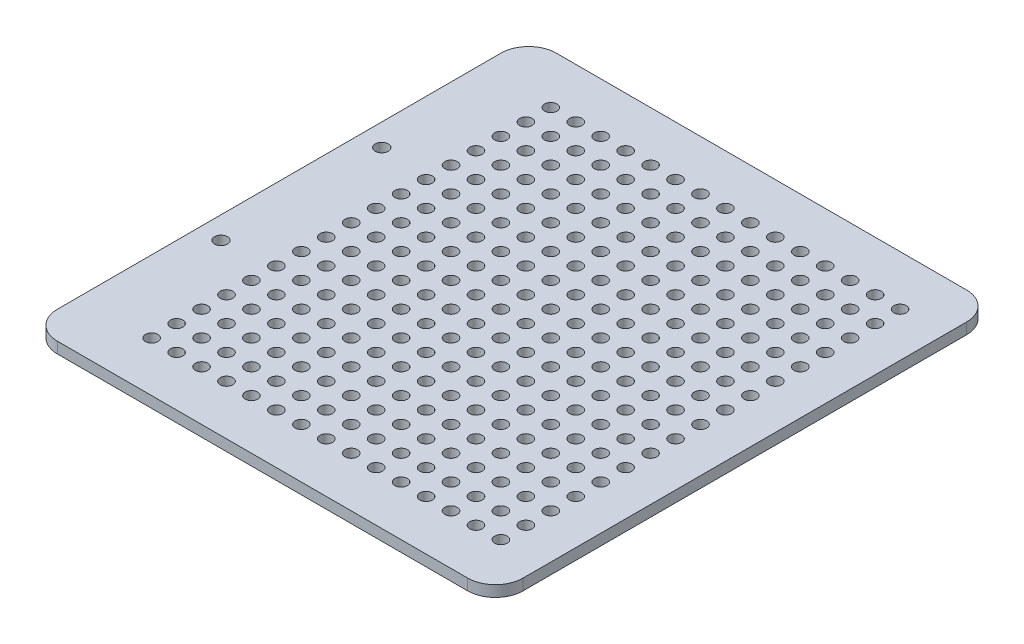
from build123d import *

# Parameters (mm, degrees)
SKETCH_1_W          = 168
SKETCH_1_H          = 180
EXTRUDE_1_DEPTH     = 4
SKETCH_3_R          = 2.336648517
CUT_EXTRUDE_1_DEPTH = 4
SKETCH_5_R          = 2.25
CUT_EXTRUDE_2_DEPTH = 4
FILLET_1_R          = 10


with BuildPart() as part:
    # 草图1 → 凸台-拉伸1 (new body)
    with BuildSketch(Plane(origin=(0, 0, 0), x_dir=(1, 0, 0), z_dir=(0, 1, 0))):
        with Locations((84, -90)):
            Rectangle(SKETCH_1_W, SKETCH_1_H)
    extrude(amount=EXTRUDE_1_DEPTH)

    # 草图3 → 切除-拉伸1 (cut)
    with BuildSketch(Plane(origin=(0, 4, 0), x_dir=(1, 0, 0), z_dir=(0, 1, 0))):
        with Locations((8, -61)):
            Circle(SKETCH_3_R)
        with Locations((8, -119)):
            Circle(SKETCH_3_R)
    extrude(amount=-CUT_EXTRUDE_1_DEPTH, mode=Mode.SUBTRACT)

    # 草图5 → 切除-拉伸2 (cut)
    with BuildSketch(Plane(origin=(0, 4, 0), x_dir=(1, 0, 0), z_dir=(0, 1, 0))):
        with Locations((26, -18)):
            Circle(SKETCH_5_R)
        with Locations((35, -18)):
            Circle(SKETCH_5_R)
        with Locations((44, -18)):
            Circle(SKETCH_5_R)
        with Locations((53, -18)):
            Circle(SKETCH_5_R)
        with Locations((62, -18)):
            Circle(SKETCH_5_R)
        with Locations((71, -18)):
            Circle(SKETCH_5_R)
        with Locations((80, -18)):
            Circle(SKETCH_5_R)
        with Locations((89, -18)):
            Circle(SKETCH_5_R)
        with Locations((98, -18)):
            Circle(SKETCH_5_R)
        with Locations((107, -18)):
            Circle(SKETCH_5_R)
        with Locations((116, -18)):
            Circle(SKETCH_5_R)
        with Locations((125, -18)):
            Circle(SKETCH_5_R)
        with Locations((134, -18)):
            Circle(SKETCH_5_R)
        with Locations((143, -18)):
            Circle(SKETCH_5_R)
        with Locations((152, -18)):
            Circle(SKETCH_5_R)
        with Locations((35, -27)):
            Circle(SKETCH_5_R)
        with Locations((44, -27)):
            Circle(SKETCH_5_R)
        with Locations((53, -27)):
            Circle(SKETCH_5_R)
        with Locations((62, -27)):
            Circle(SKETCH_5_R)
        with Locations((71, -27)):
            Circle(SKETCH_5_R)
        with Locations((80, -27)):
            Circle(SKETCH_5_R)
        with Locations((89, -27)):
            Circle(SKETCH_5_R)
        with Locations((98, -27)):
            Circle(SKETCH_5_R)
        with Locations((107, -27)):
            Circle(SKETCH_5_R)
        with Locations((116, -27)):
            Circle(SKETCH_5_R)
        with Locations((125, -27)):
            Circle(SKETCH_5_R)
        with Locations((134, -27)):
            Circle(SKETCH_5_R)
        with Locations((143, -27)):
            Circle(SKETCH_5_R)
        with Locations((152, -27)):
            Circle(SKETCH_5_R)
        with Locations((35, -36)):
            Circle(SKETCH_5_R)
        with Locations((44, -36)):
            Circle(SKETCH_5_R)
        with Locations((53, -36)):
            Circle(SKETCH_5_R)
        with Locations((62, -36)):
            Circle(SKETCH_5_R)
        with Locations((71, -36)):
            Circle(SKETCH_5_R)
        with Locations((80, -36)):
            Circle(SKETCH_5_R)
        with Locations((89, -36)):
            Circle(SKETCH_5_R)
        with Locations((98, -36)):
            Circle(SKETCH_5_R)
        with Locations((107, -36)):
            Circle(SKETCH_5_R)
        with Locations((116, -36)):
            Circle(SKETCH_5_R)
        with Locations((125, -36)):
            Circle(SKETCH_5_R)
        with Locations((134, -36)):
            Circle(SKETCH_5_R)
        with Locations((143, -36)):
            Circle(SKETCH_5_R)
        with Locations((152, -36)):
            Circle(SKETCH_5_R)
        with Locations((35, -45)):
            Circle(SKETCH_5_R)
        with Locations((44, -45)):
            Circle(SKETCH_5_R)
        with Locations((53, -45)):
            Circle(SKETCH_5_R)
        with Locations((62, -45)):
            Circle(SKETCH_5_R)
        with Locations((71, -45)):
            Circle(SKETCH_5_R)
        with Locations((80, -45)):
            Circle(SKETCH_5_R)
        with Locations((89, -45)):
            Circle(SKETCH_5_R)
        with Locations((98, -45)):
            Circle(SKETCH_5_R)
        with Locations((107, -45)):
            Circle(SKETCH_5_R)
        with Locations((116, -45)):
            Circle(SKETCH_5_R)
        with Locations((125, -45)):
            Circle(SKETCH_5_R)
        with Locations((134, -45)):
            Circle(SKETCH_5_R)
        with Locations((143, -45)):
            Circle(SKETCH_5_R)
        with Locations((152, -45)):
            Circle(SKETCH_5_R)
        with Locations((35, -54)):
            Circle(SKETCH_5_R)
        with Locations((44, -54)):
            Circle(SKETCH_5_R)
        with Locations((53, -54)):
            Circle(SKETCH_5_R)
        with Locations((62, -54)):
            Circle(SKETCH_5_R)
        with Locations((71, -54)):
            Circle(SKETCH_5_R)
        with Locations((80, -54)):
            Circle(SKETCH_5_R)
        with Locations((89, -54)):
            Circle(SKETCH_5_R)
        with Locations((98, -54)):
            Circle(SKETCH_5_R)
        with Locations((107, -54)):
            Circle(SKETCH_5_R)
        with Locations((116, -54)):
            Circle(SKETCH_5_R)
        with Locations((125, -54)):
            Circle(SKETCH_5_R)
        with Locations((134, -54)):
            Circle(SKETCH_5_R)
        with Locations((143, -54)):
            Circle(SKETCH_5_R)
        with Locations((152, -54)):
            Circle(SKETCH_5_R)
        with Locations((35, -63)):
            Circle(SKETCH_5_R)
        with Locations((44, -63)):
            Circle(SKETCH_5_R)
        with Locations((53, -63)):
            Circle(SKETCH_5_R)
        with Locations((62, -63)):
            Circle(SKETCH_5_R)
        with Locations((71, -63)):
            Circle(SKETCH_5_R)
        with Locations((80, -63)):
            Circle(SKETCH_5_R)
        with Locations((89, -63)):
            Circle(SKETCH_5_R)
        with Locations((98, -63)):
            Circle(SKETCH_5_R)
        with Locations((107, -63)):
            Circle(SKETCH_5_R)
        with Locations((116, -63)):
            Circle(SKETCH_5_R)
        with Locations((125, -63)):
            Circle(SKETCH_5_R)
        with Locations((134, -63)):
            Circle(SKETCH_5_R)
        with Locations((143, -63)):
            Circle(SKETCH_5_R)
        with Locations((152, -63)):
            Circle(SKETCH_5_R)
        with Locations((35, -72)):
            Circle(SKETCH_5_R)
        with Locations((44, -72)):
            Circle(SKETCH_5_R)
        with Locations((53, -72)):
            Circle(SKETCH_5_R)
        with Locations((62, -72)):
            Circle(SKETCH_5_R)
        with Locations((71, -72)):
            Circle(SKETCH_5_R)
        with Locations((80, -72)):
            Circle(SKETCH_5_R)
        with Locations((89, -72)):
            Circle(SKETCH_5_R)
        with Locations((98, -72)):
            Circle(SKETCH_5_R)
        with Locations((107, -72)):
            Circle(SKETCH_5_R)
        with Locations((116, -72)):
            Circle(SKETCH_5_R)
        with Locations((125, -72)):
            Circle(SKETCH_5_R)
        with Locations((134, -72)):
            Circle(SKETCH_5_R)
        with Locations((143, -72)):
            Circle(SKETCH_5_R)
        with Locations((152, -72)):
            Circle(SKETCH_5_R)
        with Locations((35, -81)):
            Circle(SKETCH_5_R)
        with Locations((44, -81)):
            Circle(SKETCH_5_R)
        with Locations((53, -81)):
            Circle(SKETCH_5_R)
        with Locations((62, -81)):
            Circle(SKETCH_5_R)
        with Locations((71, -81)):
            Circle(SKETCH_5_R)
        with Locations((80, -81)):
            Circle(SKETCH_5_R)
        with Locations((89, -81)):
            Circle(SKETCH_5_R)
        with Locations((98, -81)):
            Circle(SKETCH_5_R)
        with Locations((107, -81)):
            Circle(SKETCH_5_R)
        with Locations((116, -81)):
            Circle(SKETCH_5_R)
        with Locations((125, -81)):
            Circle(SKETCH_5_R)
        with Locations((134, -81)):
            Circle(SKETCH_5_R)
        with Locations((143, -81)):
            Circle(SKETCH_5_R)
        with Locations((152, -81)):
            Circle(SKETCH_5_R)
        with Locations((35, -90)):
            Circle(SKETCH_5_R)
        with Locations((44, -90)):
            Circle(SKETCH_5_R)
        with Locations((53, -90)):
            Circle(SKETCH_5_R)
        with Locations((62, -90)):
            Circle(SKETCH_5_R)
        with Locations((71, -90)):
            Circle(SKETCH_5_R)
        with Locations((80, -90)):
            Circle(SKETCH_5_R)
        with Locations((89, -90)):
            Circle(SKETCH_5_R)
        with Locations((98, -90)):
            Circle(SKETCH_5_R)
        with Locations((107, -90)):
            Circle(SKETCH_5_R)
        with Locations((116, -90)):
            Circle(SKETCH_5_R)
        with Locations((125, -90)):
            Circle(SKETCH_5_R)
        with Locations((134, -90)):
            Circle(SKETCH_5_R)
        with Locations((143, -90)):
            Circle(SKETCH_5_R)
        with Locations((152, -90)):
            Circle(SKETCH_5_R)
        with Locations((35, -99)):
            Circle(SKETCH_5_R)
        with Locations((44, -99)):
            Circle(SKETCH_5_R)
        with Locations((53, -99)):
            Circle(SKETCH_5_R)
        with Locations((62, -99)):
            Circle(SKETCH_5_R)
        with Locations((71, -99)):
            Circle(SKETCH_5_R)
        with Locations((80, -99)):
            Circle(SKETCH_5_R)
        with Locations((89, -99)):
            Circle(SKETCH_5_R)
        with Locations((98, -99)):
            Circle(SKETCH_5_R)
        with Locations((107, -99)):
            Circle(SKETCH_5_R)
        with Locations((116, -99)):
            Circle(SKETCH_5_R)
        with Locations((125, -99)):
            Circle(SKETCH_5_R)
        with Locations((134, -99)):
            Circle(SKETCH_5_R)
        with Locations((143, -99)):
            Circle(SKETCH_5_R)
        with Locations((152, -99)):
            Circle(SKETCH_5_R)
        with Locations((35, -108)):
            Circle(SKETCH_5_R)
        with Locations((44, -108)):
            Circle(SKETCH_5_R)
        with Locations((53, -108)):
            Circle(SKETCH_5_R)
        with Locations((62, -108)):
            Circle(SKETCH_5_R)
        with Locations((71, -108)):
            Circle(SKETCH_5_R)
        with Locations((80, -108)):
            Circle(SKETCH_5_R)
        with Locations((89, -108)):
            Circle(SKETCH_5_R)
        with Locations((98, -108)):
            Circle(SKETCH_5_R)
        with Locations((107, -108)):
            Circle(SKETCH_5_R)
        with Locations((116, -108)):
            Circle(SKETCH_5_R)
        with Locations((125, -108)):
            Circle(SKETCH_5_R)
        with Locations((134, -108)):
            Circle(SKETCH_5_R)
        with Locations((143, -108)):
            Circle(SKETCH_5_R)
        with Locations((152, -108)):
            Circle(SKETCH_5_R)
        with Locations((35, -117)):
            Circle(SKETCH_5_R)
        with Locations((44, -117)):
            Circle(SKETCH_5_R)
        with Locations((53, -117)):
            Circle(SKETCH_5_R)
        with Locations((62, -117)):
            Circle(SKETCH_5_R)
        with Locations((71, -117)):
            Circle(SKETCH_5_R)
        with Locations((80, -117)):
            Circle(SKETCH_5_R)
        with Locations((89, -117)):
            Circle(SKETCH_5_R)
        with Locations((98, -117)):
            Circle(SKETCH_5_R)
        with Locations((107, -117)):
            Circle(SKETCH_5_R)
        with Locations((116, -117)):
            Circle(SKETCH_5_R)
        with Locations((125, -117)):
            Circle(SKETCH_5_R)
        with Locations((134, -117)):
            Circle(SKETCH_5_R)
        with Locations((143, -117)):
            Circle(SKETCH_5_R)
        with Locations((152, -117)):
            Circle(SKETCH_5_R)
        with Locations((35, -126)):
            Circle(SKETCH_5_R)
        with Locations((44, -126)):
            Circle(SKETCH_5_R)
        with Locations((53, -126)):
            Circle(SKETCH_5_R)
        with Locations((62, -126)):
            Circle(SKETCH_5_R)
        with Locations((71, -126)):
            Circle(SKETCH_5_R)
        with Locations((80, -126)):
            Circle(SKETCH_5_R)
        with Locations((89, -126)):
            Circle(SKETCH_5_R)
        with Locations((98, -126)):
            Circle(SKETCH_5_R)
        with Locations((107, -126)):
            Circle(SKETCH_5_R)
        with Locations((116, -126)):
            Circle(SKETCH_5_R)
        with Locations((125, -126)):
            Circle(SKETCH_5_R)
        with Locations((134, -126)):
            Circle(SKETCH_5_R)
        with Locations((143, -126)):
            Circle(SKETCH_5_R)
        with Locations((152, -126)):
            Circle(SKETCH_5_R)
        with Locations((35, -135)):
            Circle(SKETCH_5_R)
        with Locations((44, -135)):
            Circle(SKETCH_5_R)
        with Locations((53, -135)):
            Circle(SKETCH_5_R)
        with Locations((62, -135)):
            Circle(SKETCH_5_R)
        with Locations((71, -135)):
            Circle(SKETCH_5_R)
        with Locations((80, -135)):
            Circle(SKETCH_5_R)
        with Locations((89, -135)):
            Circle(SKETCH_5_R)
        with Locations((98, -135)):
            Circle(SKETCH_5_R)
        with Locations((107, -135)):
            Circle(SKETCH_5_R)
        with Locations((116, -135)):
            Circle(SKETCH_5_R)
        with Locations((125, -135)):
            Circle(SKETCH_5_R)
        with Locations((134, -135)):
            Circle(SKETCH_5_R)
        with Locations((143, -135)):
            Circle(SKETCH_5_R)
        with Locations((152, -135)):
            Circle(SKETCH_5_R)
        with Locations((35, -144)):
            Circle(SKETCH_5_R)
        with Locations((44, -144)):
            Circle(SKETCH_5_R)
        with Locations((53, -144)):
            Circle(SKETCH_5_R)
        with Locations((62, -144)):
            Circle(SKETCH_5_R)
        with Locations((71, -144)):
            Circle(SKETCH_5_R)
        with Locations((80, -144)):
            Circle(SKETCH_5_R)
        with Locations((89, -144)):
            Circle(SKETCH_5_R)
        with Locations((98, -144)):
            Circle(SKETCH_5_R)
        with Locations((107, -144)):
            Circle(SKETCH_5_R)
        with Locations((116, -144)):
            Circle(SKETCH_5_R)
        with Locations((125, -144)):
            Circle(SKETCH_5_R)
        with Locations((134, -144)):
            Circle(SKETCH_5_R)
        with Locations((143, -144)):
            Circle(SKETCH_5_R)
        with Locations((152, -144)):
            Circle(SKETCH_5_R)
        with Locations((35, -153)):
            Circle(SKETCH_5_R)
        with Locations((44, -153)):
            Circle(SKETCH_5_R)
        with Locations((53, -153)):
            Circle(SKETCH_5_R)
        with Locations((62, -153)):
            Circle(SKETCH_5_R)
        with Locations((71, -153)):
            Circle(SKETCH_5_R)
        with Locations((80, -153)):
            Circle(SKETCH_5_R)
        with Locations((89, -153)):
            Circle(SKETCH_5_R)
        with Locations((98, -153)):
            Circle(SKETCH_5_R)
        with Locations((107, -153)):
            Circle(SKETCH_5_R)
        with Locations((116, -153)):
            Circle(SKETCH_5_R)
        with Locations((125, -153)):
            Circle(SKETCH_5_R)
        with Locations((134, -153)):
            Circle(SKETCH_5_R)
        with Locations((143, -153)):
            Circle(SKETCH_5_R)
        with Locations((152, -153)):
            Circle(SKETCH_5_R)
        with Locations((35, -162)):
            Circle(SKETCH_5_R)
        with Locations((44, -162)):
            Circle(SKETCH_5_R)
        with Locations((53, -162)):
            Circle(SKETCH_5_R)
        with Locations((62, -162)):
            Circle(SKETCH_5_R)
        with Locations((71, -162)):
            Circle(SKETCH_5_R)
        with Locations((80, -162)):
            Circle(SKETCH_5_R)
        with Locations((89, -162)):
            Circle(SKETCH_5_R)
        with Locations((98, -162)):
            Circle(SKETCH_5_R)
        with Locations((107, -162)):
            Circle(SKETCH_5_R)
        with Locations((116, -162)):
            Circle(SKETCH_5_R)
        with Locations((125, -162)):
            Circle(SKETCH_5_R)
        with Locations((134, -162)):
            Circle(SKETCH_5_R)
        with Locations((143, -162)):
            Circle(SKETCH_5_R)
        with Locations((152, -162)):
            Circle(SKETCH_5_R)
        with Locations((26, -27)):
            Circle(SKETCH_5_R)
        with Locations((26, -36)):
            Circle(SKETCH_5_R)
        with Locations((26, -45)):
            Circle(SKETCH_5_R)
        with Locations((26, -54)):
            Circle(SKETCH_5_R)
        with Locations((26, -63)):
            Circle(SKETCH_5_R)
        with Locations((26, -72)):
            Circle(SKETCH_5_R)
        with Locations((26, -81)):
            Circle(SKETCH_5_R)
        with Locations((26, -90)):
            Circle(SKETCH_5_R)
        with Locations((26, -99)):
            Circle(SKETCH_5_R)
        with Locations((26, -108)):
            Circle(SKETCH_5_R)
        with Locations((26, -117)):
            Circle(SKETCH_5_R)
        with Locations((26, -126)):
            Circle(SKETCH_5_R)
        with Locations((26, -135)):
            Circle(SKETCH_5_R)
        with Locations((26, -144)):
            Circle(SKETCH_5_R)
        with Locations((26, -153)):
            Circle(SKETCH_5_R)
        with Locations((26, -162)):
            Circle(SKETCH_5_R)
    extrude(amount=-CUT_EXTRUDE_2_DEPTH, mode=Mode.SUBTRACT)

    # 圆角1
    fillet_1_edges = [part.edges().sort_by_distance(p)[0] for p in [
        (0, 2, 180),
        (168, 2, 180),
        (168, 2, 0),
        (0, 2, 0),
    ]]
    fillet(fillet_1_edges, radius=FILLET_1_R)


solid = part.part
